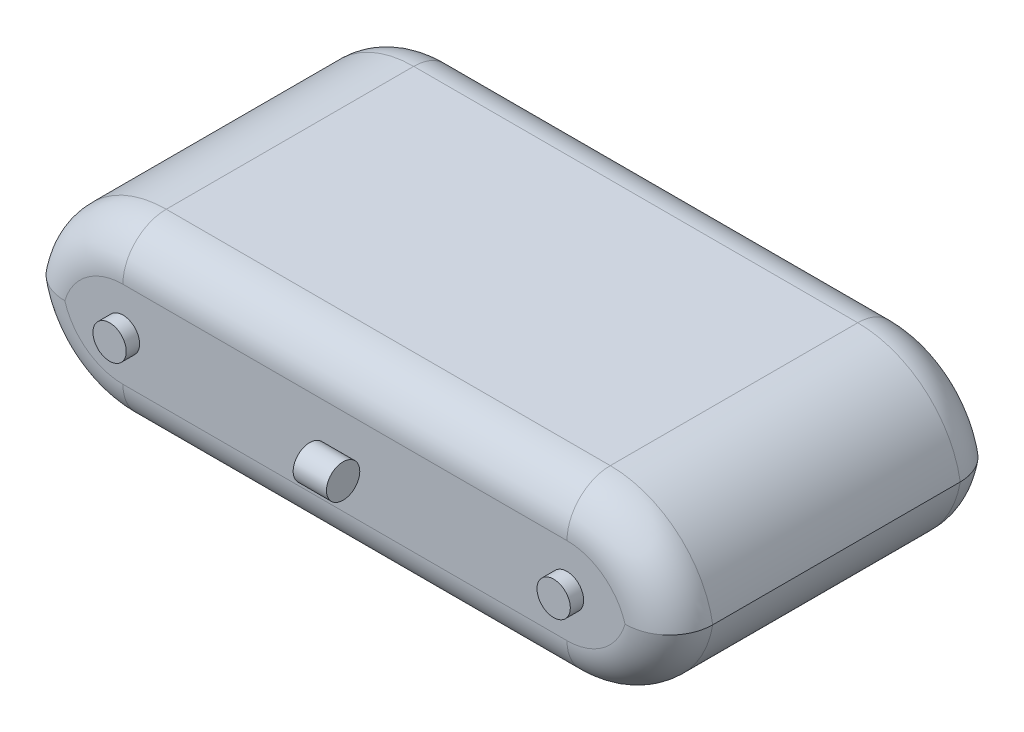
from build123d import *

# Parameters (mm, degrees)
SKETCH1_W             = 75.266699621
SKETCH1_H             = 38.570835393
BOSS_EXTRUDE1_DEPTH   = 20
FILLET1_R             = 12
FILLET3_R             = 5
SCALE1_SCALE          = 13
SKETCH2_R             = 25
BOSS_EXTRUDE2_DEPTH   = 20
BOSS_EXTRUDE3_START   = 20
SKETCH3_R             = 25
BOSS_EXTRUDE3_DEPTH   = 20
SKETCH6_R             = 25
BOSS_EXTRUDE5_DEPTH   = 25
BOSS_EXTRUDE5_2_DEPTH = 25


with BuildPart() as part:
    # Sketch1 → Boss-Extrude1 (new body)
    with BuildSketch(Plane(origin=(0, 0, 0), x_dir=(1, 0, 0), z_dir=(0, 1, 0))):
        with Locations((2.2767507, -2.2767507)):
            Rectangle(SKETCH1_W, SKETCH1_H)
    extrude(amount=BOSS_EXTRUDE1_DEPTH)

    # Fillet1
    # the kernel refuses this fillet: 12 mm, written as the material it takes off along each edge
    with BuildSketch(Plane(origin=(39.910100511, 20, -47.008666996), x_dir=(0, -1, 0), z_dir=(0, 0, 1)), Plane(origin=(-35.35659911, 20, 51.562168397), x_dir=(0, -1, 0), z_dir=(0, 0, -1))) as fillet1_piece_1:
        with BuildLine():
            CenterArc((FILLET1_R, -FILLET1_R), FILLET1_R, 90, 90)
            Line((0, -FILLET1_R), (0, 0))
            Line((0, 0), (FILLET1_R, 0))
        make_face()
    extrude(amount=98.570835393, mode=Mode.SUBTRACT)
    with BuildSketch(Plane(origin=(39.910100511, 0, -47.008666996), x_dir=(0, 1, 0), z_dir=(0, 0, 1)), Plane(origin=(-35.35659911, 0, 51.562168397), x_dir=(0, 1, 0), z_dir=(0, 0, -1))) as fillet1_piece_2:
        with BuildLine():
            CenterArc((FILLET1_R, FILLET1_R), FILLET1_R, 180, 90)
            Line((0, FILLET1_R), (0, 0))
            Line((0, 0), (FILLET1_R, 0))
        make_face()
    extrude(amount=98.570835393, mode=Mode.SUBTRACT)

    # Fillet3
    # the kernel refuses this fillet: 5 mm, written as the material it takes off along each edge
    with BuildSketch(Plane(origin=(27.910100511, 0, 21.562168397), x_dir=(0, 0, -1), z_dir=(-1, 0, 0)), Plane(origin=(-23.35659911, 20, -17.008666996), x_dir=(0, -1, 0), z_dir=(1, 0, 0))) as fillet3_piece_1:
        with BuildLine():
            CenterArc((FILLET3_R, -FILLET3_R), FILLET3_R, 90, 90)
            Line((0, -FILLET3_R), (0, 0))
            Line((0, 0), (FILLET3_R, 0))
        make_face()
    extrude(amount=51.266699621, mode=Mode.SUBTRACT)
    with BuildSketch(Plane(origin=(27.910100511, 20, 21.562168397), x_dir=(0, 0, -1), z_dir=(-1, 0, 0)), Plane(origin=(-23.35659911, 0, -17.008666996), x_dir=(0, 1, 0), z_dir=(1, 0, 0))) as fillet3_piece_2:
        with BuildLine():
            CenterArc((FILLET3_R, FILLET3_R), FILLET3_R, 180, 90)
            Line((0, FILLET3_R), (0, 0))
            Line((0, 0), (FILLET3_R, 0))
        make_face()
    extrude(amount=51.266699621, mode=Mode.SUBTRACT)
    with BuildSketch(Plane(origin=(27.910100511, 12, 21.562168397), x_dir=(0.6413402265128234, 0.7672566153878899, 0), z_dir=(-0.7672566153878899, 0.6413402265128234, 0))) as fillet3_piece_3:
        with BuildLine():
            CenterArc((12 - FILLET3_R, FILLET3_R), FILLET3_R, 270, 90)
            Line((12 - FILLET3_R, 0), (12, 0))
            Line((12, 0), (12, FILLET3_R))
        make_face()
    revolve(axis=Axis((27.910100511, 12, 21.562168397), (0, 0, -1)), revolution_arc=140.108170437, mode=Mode.SUBTRACT)
    with BuildSketch(Plane(origin=(27.910100511, 8, 21.562168397), x_dir=(0, 1, 0), z_dir=(-1, 0, 0))) as fillet3_piece_4:
        with BuildLine():
            CenterArc((12 - FILLET3_R, FILLET3_R), FILLET3_R, 270, 90)
            Line((12 - FILLET3_R, 0), (12, 0))
            Line((12, 0), (12, FILLET3_R))
        make_face()
    revolve(axis=Axis((27.910100511, 8, 21.562168397), (0, 0, -1)), revolution_arc=140.108170437, mode=Mode.SUBTRACT)
    with BuildSketch(Plane(origin=(-23.35659911, 8, 21.562168397), x_dir=(0, 1, 0), z_dir=(1, 0, 0))) as fillet3_piece_5:
        with BuildLine():
            CenterArc((12 - FILLET3_R, -FILLET3_R), FILLET3_R, 0, 90)
            Line((12 - FILLET3_R, 0), (12, 0))
            Line((12, 0), (12, -FILLET3_R))
        make_face()
    revolve(axis=Axis((-23.35659911, 8, 21.562168397), (0, 0, 1)), revolution_arc=140.108170437, mode=Mode.SUBTRACT)
    with BuildSketch(Plane(origin=(-23.35659911, 12, 21.562168397), x_dir=(-0.6413402265128229, 0.7672566153878903, 0), z_dir=(0.7672566153878903, 0.6413402265128229, 0))) as fillet3_piece_6:
        with BuildLine():
            CenterArc((12 - FILLET3_R, -FILLET3_R), FILLET3_R, 0, 90)
            Line((12 - FILLET3_R, 0), (12, 0))
            Line((12, 0), (12, -FILLET3_R))
        make_face()
    revolve(axis=Axis((-23.35659911, 12, 21.562168397), (0, 0, 1)), revolution_arc=140.108170437, mode=Mode.SUBTRACT)
    with BuildSketch(Plane(origin=(27.910100511, 12, -17.008666996), x_dir=(0.6413402265128234, 0.7672566153878899, 0), z_dir=(-0.7672566153878899, 0.6413402265128234, 0))) as fillet3_piece_7:
        with BuildLine():
            CenterArc((12 - FILLET3_R, -FILLET3_R), FILLET3_R, 0, 90)
            Line((12, -FILLET3_R), (12, 0))
            Line((12, 0), (12 - FILLET3_R, 0))
        make_face()
    revolve(axis=Axis((27.910100511, 12, -17.008666996), (0, 0, -1)), revolution_arc=140.108170437, mode=Mode.SUBTRACT)
    with BuildSketch(Plane(origin=(27.910100511, 8, -17.008666996), x_dir=(0, 1, 0), z_dir=(-1, 0, 0))) as fillet3_piece_8:
        with BuildLine():
            CenterArc((12 - FILLET3_R, -FILLET3_R), FILLET3_R, 0, 90)
            Line((12, -FILLET3_R), (12, 0))
            Line((12, 0), (12 - FILLET3_R, 0))
        make_face()
    revolve(axis=Axis((27.910100511, 8, -17.008666996), (0, 0, -1)), revolution_arc=140.108170437, mode=Mode.SUBTRACT)
    with BuildSketch(Plane(origin=(-23.35659911, 8, -17.008666996), x_dir=(0, 1, 0), z_dir=(1, 0, 0))) as fillet3_piece_9:
        with BuildLine():
            CenterArc((12 - FILLET3_R, FILLET3_R), FILLET3_R, 270, 90)
            Line((12, FILLET3_R), (12, 0))
            Line((12, 0), (12 - FILLET3_R, 0))
        make_face()
    revolve(axis=Axis((-23.35659911, 8, -17.008666996), (0, 0, 1)), revolution_arc=140.108170437, mode=Mode.SUBTRACT)
    with BuildSketch(Plane(origin=(-23.35659911, 12, -17.008666996), x_dir=(-0.6413402265128236, 0.7672566153878898, 0), z_dir=(0.7672566153878898, 0.6413402265128236, 0))) as fillet3_piece_10:
        with BuildLine():
            CenterArc((12 - FILLET3_R, FILLET3_R), FILLET3_R, 270, 90)
            Line((12, FILLET3_R), (12, 0))
            Line((12, 0), (12 - FILLET3_R, 0))
        make_face()
    revolve(axis=Axis((-23.35659911, 12, -17.008666996), (0, 0, 1)), revolution_arc=140.108170437, mode=Mode.SUBTRACT)


with BuildPart() as part_1:
    # Scale1: scaled about (2.276750701, 9.999999998, 2.2767507)
    add(part.part.scale(SCALE1_SCALE).moved(Location((-27.321008412, -119.999999976, -27.3210084))))

    # Sketch2 → Boss-Extrude2 (add)
    with BuildSketch(Plane.XY.offset(252.987180755)):
        with Locations(Location((-330.956796836, 10, 0), (0, 0, 180))):
            Circle(SKETCH2_R)
        with Locations(Location((335.510298237, 10, 0), (0, 0, 180))):
            Circle(SKETCH2_R)
    extrude(amount=BOSS_EXTRUDE2_DEPTH)

    # Sketch3 → Boss-Extrude3 (add)
    with BuildSketch(Plane(origin=(0, 0, -248.433679354), x_dir=(-1, 0, 0), z_dir=(0, 0, -1)).offset(BOSS_EXTRUDE3_START)):
        with Locations((-335.510298237, 10)):
            Circle(SKETCH3_R)
        with Locations((330.956796836, 10)):
            Circle(SKETCH3_R)
    extrude(amount=-BOSS_EXTRUDE3_DEPTH)


with BuildPart() as body_2:
    # Sketch6 → Boss-Extrude5 (new, symmetric)
    with BuildSketch(Plane(origin=(0, 0, 0), x_dir=(0, 0, -1), z_dir=(1, 0, 0))):
        with Locations((-278.464422179, 10)):
            Circle(SKETCH6_R)
    extrude(amount=BOSS_EXTRUDE5_DEPTH, both=True)


with BuildPart() as body_3:
    # Sketch6 → Boss-Extrude5 2 (new, symmetric)
    with BuildSketch(Plane(origin=(0, 0, 0), x_dir=(0, 0, -1), z_dir=(1, 0, 0))):
        with Locations((273.851995382, 10)):
            Circle(SKETCH6_R)
    extrude(amount=BOSS_EXTRUDE5_2_DEPTH, both=True)


solid = Compound([part_1.part, body_2.part, body_3.part])
